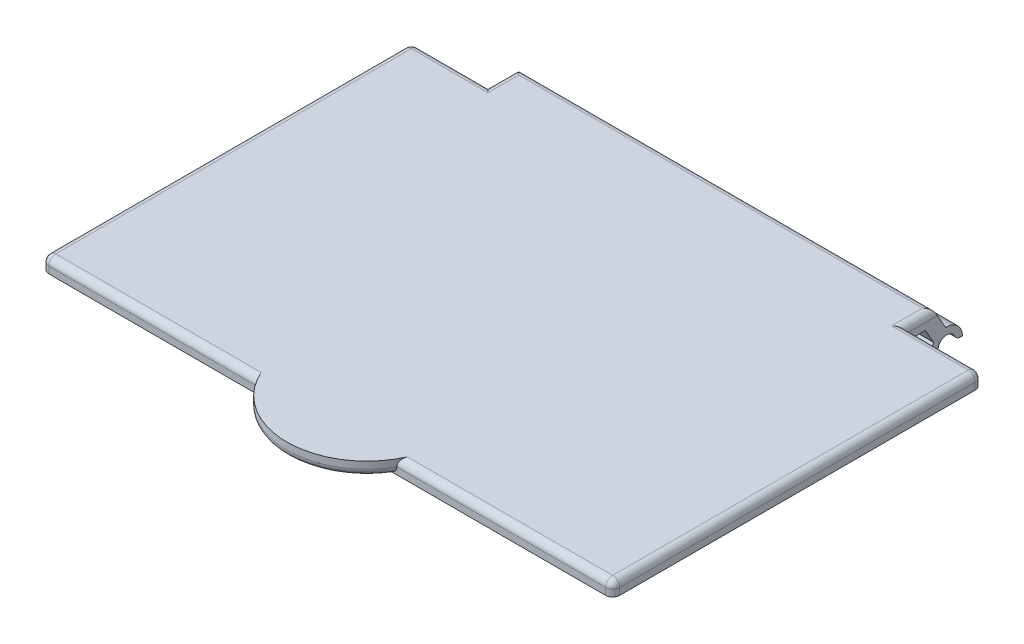
from build123d import *

# Parameters (mm, degrees)
BOSS_EXTRUDE1_DEPTH = 41
CUT_EXTRUDE1_DEPTH  = 11
BOSS_EXTRUDE4_DEPTH = 2
FILLET1_R           = 1


with BuildPart() as part:
    # Sketch2 → Boss-Extrude1 (new, symmetric)
    with BuildSketch(Plane(origin=(0, 0, 0), x_dir=(0, 0, -1), z_dir=(1, 0, 0))):
        with BuildLine():
            Line((-0.141756815, 2.245530005), (-1.922649731, 5.330127019))
            Line((-1.922649731, 5.330127019), (-59, 5.330127019))
            Line((-59, 5.330127019), (-59, 3.330127019))
            Line((-59, 3.330127019), (-3.077350269, 3.330127019))
            Line((-3.077350269, 3.330127019), (-1.873807622, 1.245530005))
            ThreePointArc((-1.873807622, 1.245530005), (-1.983045954, -1.063028101), (0, -2.25))
            Line((0, -2.25), (0, -1.25))
            ThreePointArc((0, -1.25), (-0.883883476, 0.883883476), (1.25, 0))
            Line((1.25, 0), (2.25, 0))
            ThreePointArc((2.25, 0), (1.540056357, 1.640343384), (-0.141756815, 2.245530005))
        make_face()
    extrude(amount=BOSS_EXTRUDE1_DEPTH, both=True)

    # Sketch4 → Cut-Extrude1 (cut)
    with BuildSketch(Plane(origin=(41, 0, 0), x_dir=(0, 0, -1), z_dir=(1, 0, 0))):
        with BuildLine():
            Line((-3.077350269, 3.330127019), (-1.873807622, 1.245530005))
            ThreePointArc((-1.873807622, 1.245530005), (-1.983045954, -1.063028101), (0, -2.25))
            Line((0, -2.25), (0, -1.25))
            ThreePointArc((0, -1.25), (-0.883883476, 0.883883476), (1.25, 0))
            Line((1.25, 0), (2.25, 0))
            ThreePointArc((2.25, 0), (1.540056357, 1.640343384), (-0.141756815, 2.245530005))
            Line((-0.141756815, 2.245530005), (-1.922649731, 5.330127019))
            Line((-1.922649731, 5.330127019), (-5.922649731, 5.330127019))
            Line((-5.922649731, 5.330127019), (-5.922649731, 3.330127019))
            Line((-5.922649731, 3.330127019), (-3.077350269, 3.330127019))
        make_face()
    cut_extrude1 = extrude(amount=-CUT_EXTRUDE1_DEPTH, mode=Mode.SUBTRACT)

    # Mirror1: Cut-Extrude1 across plane
    add(cut_extrude1.mirror(Plane(origin=(0, 0, 0), x_dir=(0, 0, 1), z_dir=(1, 0, 0))), mode=Mode.SUBTRACT)

    # Sketch8 → Boss-Extrude4 (add)
    with BuildSketch(Plane(origin=(0, 5.330127019, 0), x_dir=(1, 0, 0), z_dir=(0, 1, 0))):
        with BuildLine():
            Line((0, -59), (-9.997341071, -59))
            ThreePointArc((-9.997341071, -59), (0, -64.816412092), (9.997341071, -59))
            Line((9.997341071, -59), (0, -59))
        make_face()
    extrude(amount=-BOSS_EXTRUDE4_DEPTH)

    # Fillet1
    fillet1_edges = [part.edges().sort_by_distance(p)[0] for p in [
        (-35.5, 5.330127019, 5.922649731),
        (35.5, 5.330127019, 5.922649731),
        (-41, 4.330127019, 59),
        (41, 4.330127019, 59),
        (41, 5.330127019, 32.461324865),
        (-25.498670535, 5.330127019, 59),
        (25.498670535, 5.330127019, 59),
        (-41, 5.330127019, 32.461324865),
        (41, 4.330127019, 5.922649731),
        (-41, 4.330127019, 5.922649731),
        (30, 5.330127019, 3.922649731),
        (-30, 5.330127019, 3.922649731),
        (0, 5.330127019, 1.922649731),
        (0, 3.330127019, 64.816412092),
        (0, -1.25, 0),
        (0, 0, -1.25),
    ]]
    fillet(fillet1_edges, radius=FILLET1_R - 0.0001)  # a hair under: the kernel refuses the full size


solid = part.part
